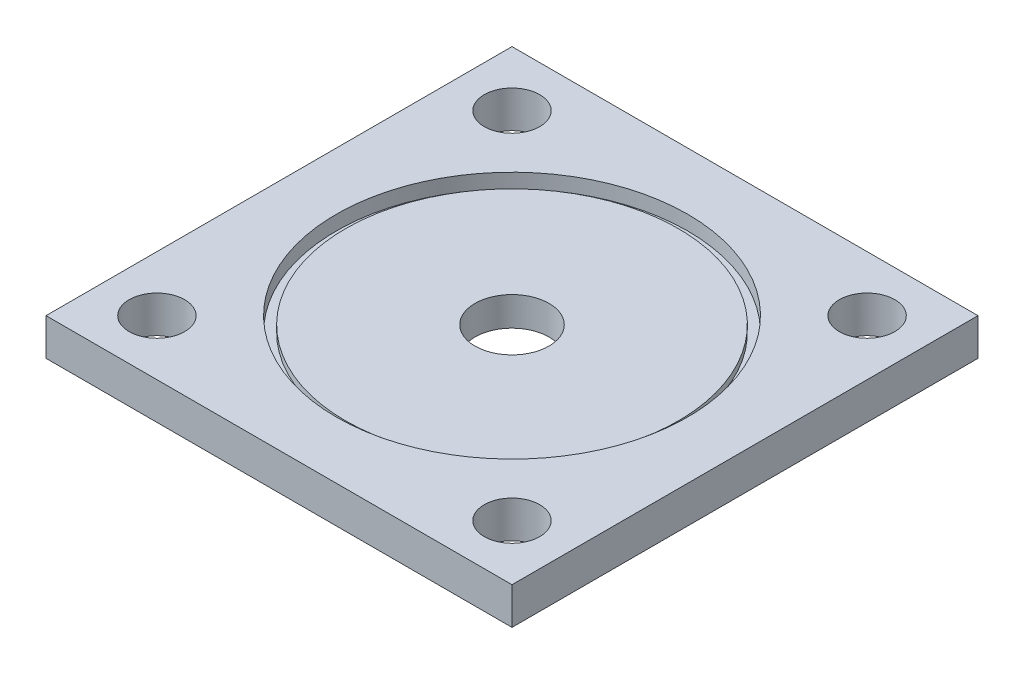
from build123d import *

# Parameters (mm, degrees)
PLATEOUTLINE_W      = 80
PLATEOUTLINE_H      = 80
BOSS_EXTRUDE1_DEPTH = 6.35
RAILGUIDES_R        = 4.7625
CUT_EXTRUDE1_DEPTH  = 10
CUT_EXTRUDE2_START  = 5
FUELGRAINMOUNTING_R = 30.1625
CUT_EXTRUDE2_DEPTH  = 5
GASINTAKE_R         = 6.35
CUT_EXTRUDE3_DEPTH  = 5
CUT_EXTRUDE4_START  = 3.857
SKETCH1_R           = 30.1625
SKETCH1_R_2         = 28.575
CUT_EXTRUDE4_DEPTH  = 1.143


with BuildPart() as part:
    # plateOutline → Boss-Extrude1 (new body)
    with BuildSketch(Plane(origin=(0, 0, 0), x_dir=(1, 0, 0), z_dir=(0, 1, 0))):
        Rectangle(PLATEOUTLINE_W, PLATEOUTLINE_H)
    extrude(amount=BOSS_EXTRUDE1_DEPTH)

    # railGuides → Cut-Extrude1 (cut)
    with BuildSketch(Plane(origin=(0, 0, 0), x_dir=(1, 0, 0), z_dir=(0, 1, 0))):
        with Locations((-30.48, 30.48)):
            Circle(RAILGUIDES_R)
        with Locations((30.48, 30.48)):
            Circle(RAILGUIDES_R)
        with Locations((30.48, -30.48)):
            Circle(RAILGUIDES_R)
        with Locations((-30.48, -30.48)):
            Circle(RAILGUIDES_R)
    extrude(amount=CUT_EXTRUDE1_DEPTH, mode=Mode.SUBTRACT)

    # FuelGrainMounting → Cut-Extrude2 (cut)
    with BuildSketch(Plane(origin=(0, 0, 0), x_dir=(1, 0, 0), z_dir=(0, 1, 0)).offset(CUT_EXTRUDE2_START)):
        Circle(FUELGRAINMOUNTING_R)
    extrude(amount=CUT_EXTRUDE2_DEPTH, mode=Mode.SUBTRACT)

    # GasIntake → Cut-Extrude3 (cut)
    with BuildSketch(Plane(origin=(0, 0, 0), x_dir=(1, 0, 0), z_dir=(0, 1, 0))):
        Circle(GASINTAKE_R)
    extrude(amount=CUT_EXTRUDE3_DEPTH, mode=Mode.SUBTRACT)

    # Sketch1 → Cut-Extrude4 (cut)
    with BuildSketch(Plane(origin=(0, 0, 0), x_dir=(1, 0, 0), z_dir=(0, 1, 0)).offset(CUT_EXTRUDE4_START)):
        Circle(SKETCH1_R)
        Circle(SKETCH1_R_2, mode=Mode.SUBTRACT)
    extrude(amount=CUT_EXTRUDE4_DEPTH, mode=Mode.SUBTRACT)


solid = part.part
